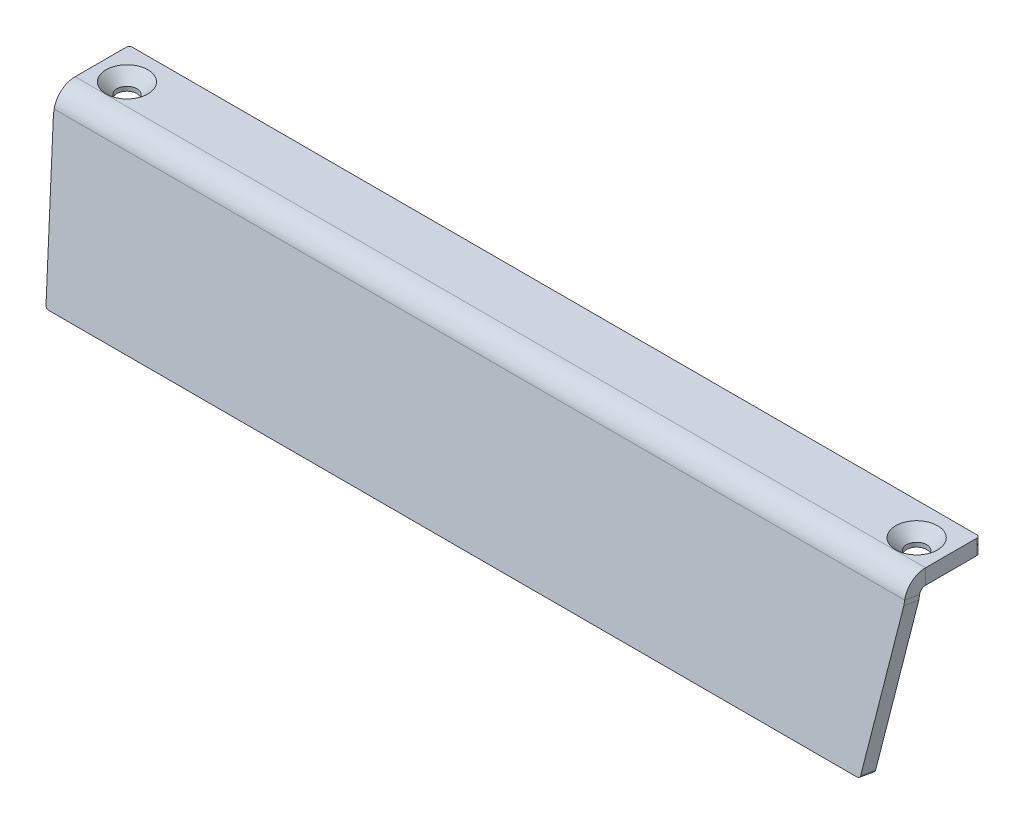
from build123d import *

# Parameters (mm, degrees)
SKETCH1_W          = 140
SKETCH1_H          = 8.92
BASE_FLANGE1_DEPTH = 2.5
EDGE_FLANGE1_DEPTH = 140
SKETCH21_R         = 1.65
CUT_EXTRUDE1_DEPTH = 78.265670645
CHAMFER1_SIZE      = 3
CHAMFER1_SIZE2     = 24.433039284
FILLET1_R          = 0.5


# Sheet-metal steps are written as plain solids
with BuildPart() as part:
    # Sketch1 → Base-Flange1 (new body)
    with BuildSketch(Plane(origin=(0, 0, 0), x_dir=(1, 0, 0), z_dir=(0, 1, 0))):
        with Locations((0, -4.46)):
            Rectangle(SKETCH1_W, SKETCH1_H)
    extrude(amount=-BASE_FLANGE1_DEPTH)

    # Edge-Flange1 section (across the edge) → Edge-Flange1 (add)
    with BuildSketch(Plane(origin=(70, -2.5, 9.759099631), x_dir=(0, -0.17364817766693427, -0.9848077530122075), z_dir=(-1, 0, 0))):
        with BuildLine():
            Line((-2.5, 0.839099631), (-2.5, 26))
            Line((-2.5, 26), (0, 26))
            Line((0, 26), (0, 0.839099631))
            ThreePointArc((0, 0.839099631), (0.233955557, 0.196312021), (0.826351822, -0.145708122))
            Line((0.826351822, -0.145708122), (0.392231378, -2.607727504))
            ThreePointArc((0.392231378, -2.607727504), (-1.681155551, -1.410657003), (-2.5, 0.839099631))
        make_face()
    extrude(amount=EDGE_FLANGE1_DEPTH)

    # Sketch21 → Cut-Extrude1 (cut, through all)
    with BuildSketch(Plane(origin=(0, 0, 0), x_dir=(1, 0, 0), z_dir=(0, 1, 0))):
        with Locations(Location((-65, -5.39, 0), (0, 0, 270))):
            Circle(SKETCH21_R)
        with Locations(Location((65, -5.39, 0), (0, 0, 270))):
            Circle(SKETCH21_R)
    extrude(amount=-CUT_EXTRUDE1_DEPTH, mode=Mode.SUBTRACT)

    # Sketch24 → Cut-Revolve2 (revolve, cut)
    with BuildSketch(Plane(origin=(65, 0, 0), x_dir=(0, 0, -1), z_dir=(1, 0, 0)), mode=Mode.PRIVATE) as cut_revolve2_sk:
        Polygon((-5.39, 0), (-5.39, -1.8), (-3.74, -1.8), (-1.94, 0), align=None)
    cut_revolve2 = revolve(cut_revolve2_sk.sketch.rotate(Axis((65, 0, 5.39), (0, 1, 0)), 180), axis=Axis((65, 0, 5.39), (0, 1, 0)), mode=Mode.SUBTRACT)

    # Mirror2: Cut-Revolve2 across plane
    add(cut_revolve2.mirror(Plane(origin=(0, 0, 0), x_dir=(0, 0, 1), z_dir=(1, 0, 0))), mode=Mode.SUBTRACT)

    # Chamfer1
    chamfer1_edges = [part.edges().sort_by_distance(p)[0] for p in [
        (70, -27.887941356, 15.504961942),
        (-70, -27.887941356, 15.504961942),
    ]]
    chamfer1_side = [part.faces().sort_by_distance(p)[0] for p in [
        (0, -27.887941356, 15.504961942),
    ]]
    chamfer(chamfer1_edges, length=CHAMFER1_SIZE, length2=CHAMFER1_SIZE2, reference=chamfer1_side[0])

    # Fillet1
    fillet1_edges = [part.edges().sort_by_distance(p)[0] for p in [
        (67, -27.887941356, 15.504961942),
        (-67, -27.887941356, 15.504961942),
        (-70, -1.25, 0),
        (70, -1.25, 0),
    ]]
    fillet(fillet1_edges, radius=FILLET1_R)


solid = part.part
